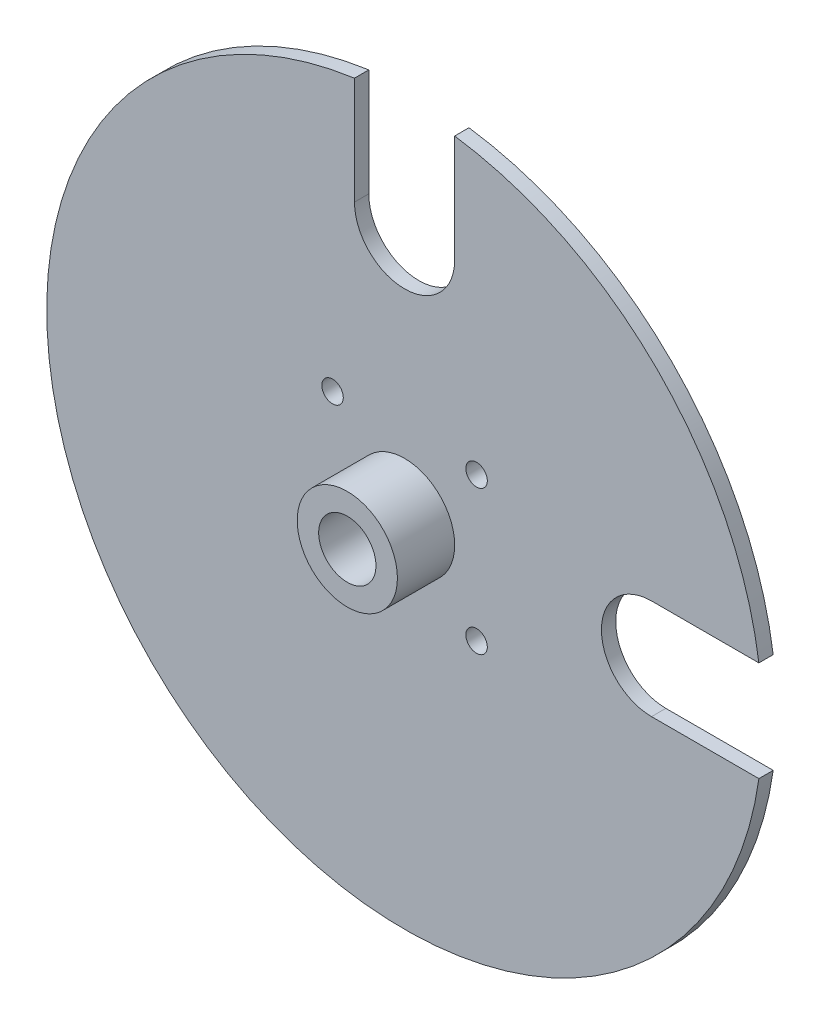
from build123d import *

# Parameters (mm, degrees)
SKETCH1_R               = 20
SKETCH1_R_2             = 4
SKETCH1_R_3             = 1.5
BOSS_EXTRUDE1_DEPTH     = 5
SKETCH2_R               = 7
SKETCH2_R_2             = 4
BOSS_EXTRUDE2_DEPTH     = 10
SKETCH3_R               = 50
SKETCH3_R_2             = 4
BOSS_EXTRUDE3_DEPTH     = 2
CUT_EXTRUDE1_START      = -2
CUT_EXTRUDE1_DEPTH      = 2
CUT_EXTRUDE2_DEPTH      = 73.284161474
CUT_EXTRUDE2_DEPTH_BACK = 73.284161474
SKETCH5_R               = 1.5


with BuildPart() as part:
    # Sketch1 → Boss-Extrude1 (new body)
    with BuildSketch(Plane.XY):
        Circle(SKETCH1_R)
        Circle(SKETCH1_R_2, mode=Mode.SUBTRACT)
        with Locations((-10.061951403, 10.061951403)):
            Circle(SKETCH1_R_3, mode=Mode.SUBTRACT)
        with Locations((10.061951403, 10.061951403)):
            Circle(SKETCH1_R_3, mode=Mode.SUBTRACT)
        with Locations((10.061951403, -10.061951403)):
            Circle(SKETCH1_R_3, mode=Mode.SUBTRACT)
        with Locations((-10.061951403, -10.061951403)):
            Circle(SKETCH1_R_3, mode=Mode.SUBTRACT)
    extrude(amount=BOSS_EXTRUDE1_DEPTH)

    # Sketch2 → Boss-Extrude2 (add)
    with BuildSketch(Plane.XY.offset(5)):
        Circle(SKETCH2_R)
        Circle(SKETCH2_R_2, mode=Mode.SUBTRACT)
    extrude(amount=BOSS_EXTRUDE2_DEPTH)

    # Sketch3 → Boss-Extrude3 (add)
    with BuildSketch(Plane.XY.offset(5)):
        Circle(SKETCH3_R)
        Circle(SKETCH3_R_2, mode=Mode.SUBTRACT)
    extrude(amount=BOSS_EXTRUDE3_DEPTH)

    # Sketch4 → Cut-Extrude1 (cut)
    with BuildSketch(Plane.XY.offset(7).offset(CUT_EXTRUDE1_START)):
        with BuildLine():
            Line((-7, 49.507575178), (-7, 34.507575178))
            ThreePointArc((-7, 34.507575178), (0, 27.507575178), (7, 34.507575178))
            Line((7, 34.507575178), (7, 49.507575178))
            ThreePointArc((7, 49.507575178), (0, 50), (-7, 49.507575178))
        make_face()
        with BuildLine():
            Line((49.507575178, -7), (34.507575178, -7))
            ThreePointArc((34.507575178, -7), (27.507575178, 0), (34.507575178, 7))
            Line((34.507575178, 7), (49.507575178, 7))
            ThreePointArc((49.507575178, 7), (50, 0), (49.507575178, -7))
        make_face()
    extrude(amount=CUT_EXTRUDE1_DEPTH, mode=Mode.SUBTRACT)

    # Sketch5 → Cut-Extrude2 (cut, two sides: drawn at the far end of the back side and taken through both)
    with BuildSketch(Plane(origin=(0, 0, 0), x_dir=(-1, 0, 0), z_dir=(0, 0, -1)).offset(-CUT_EXTRUDE2_DEPTH_BACK)):
        with Locations((-10.061951403, 10.061951403)):
            Circle(SKETCH5_R)
        with Locations((-10.061951403, -10.061951403)):
            Circle(SKETCH5_R)
        with Locations((10.061951403, 10.061951403)):
            Circle(SKETCH5_R)
        with Locations((10.061951403, -10.061951403)):
            Circle(SKETCH5_R)
    extrude(amount=CUT_EXTRUDE2_DEPTH + CUT_EXTRUDE2_DEPTH_BACK, mode=Mode.SUBTRACT)


solid = part.part
